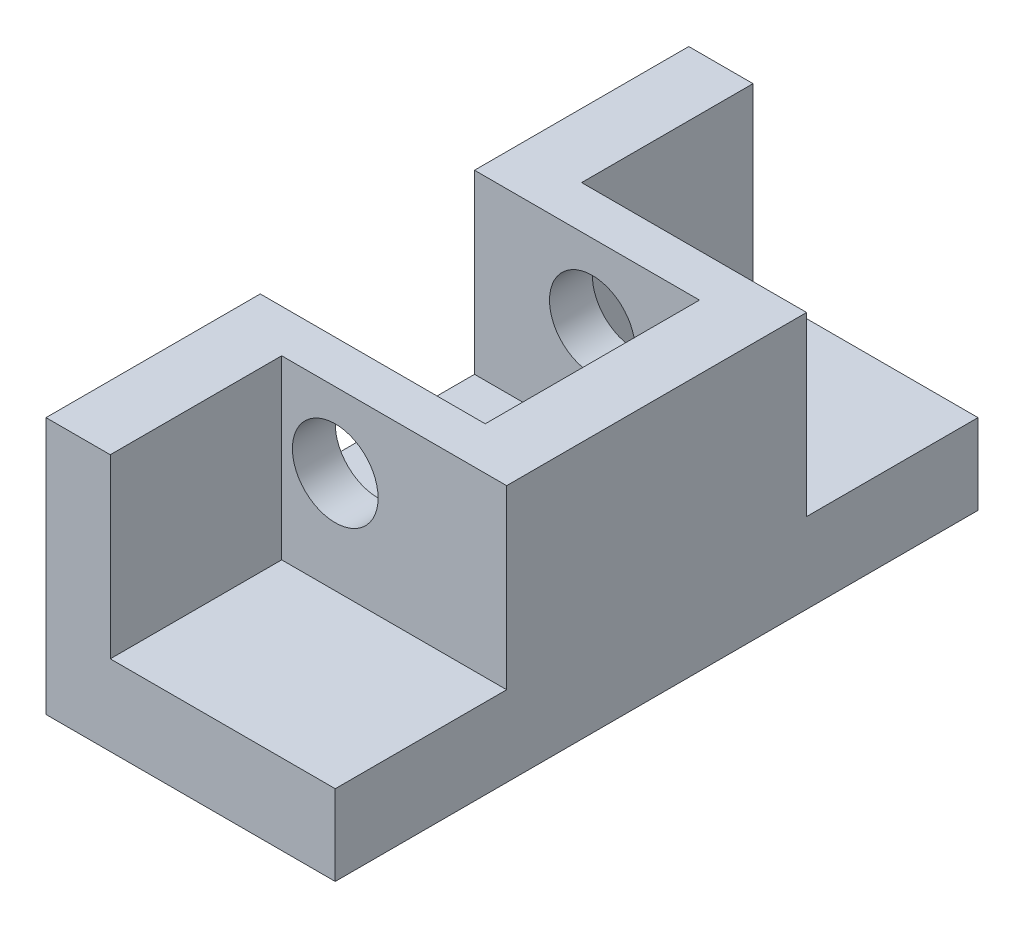
from build123d import *

# Parameters (mm, degrees)
SKETCH2_W           = 27
SKETCH2_H           = 60
BOSS_EXTRUDE1_DEPTH = 7.5
BOSS_EXTRUDE2_DEPTH = 16.5
SKETCH4_R           = 4
CUT_EXTRUDE1_DEPTH  = 52.906165337


with BuildPart() as part:
    # Sketch2 → Boss-Extrude1 (new body)
    with BuildSketch(Plane(origin=(0, 0, 0), x_dir=(1, 0, 0), z_dir=(0, 1, 0))):
        Rectangle(SKETCH2_W, SKETCH2_H)
    extrude(amount=BOSS_EXTRUDE1_DEPTH)

    # Sketch3 → Boss-Extrude2 (add)
    with BuildSketch(Plane(origin=(0, 7.5, 0), x_dir=(1, 0, 0), z_dir=(0, 1, 0))):
        Polygon((-13.5, -30), (-7.5, -30), (-7.5, -14), (13.5, -14), (13.5, 14), (-7.5, 14), (-7.5, 30), (-13.5, 30), (-13.5, 10), (7.5, 10), (7.5, -10), (-13.5, -10), align=None)
    extrude(amount=BOSS_EXTRUDE2_DEPTH)

    # Sketch4 → Cut-Extrude1 (cut, through all)
    with BuildSketch(Plane.XY.offset(14)):
        with Locations((-2.5, 17)):
            Circle(SKETCH4_R)
    extrude(amount=-CUT_EXTRUDE1_DEPTH, mode=Mode.SUBTRACT)


solid = part.part
